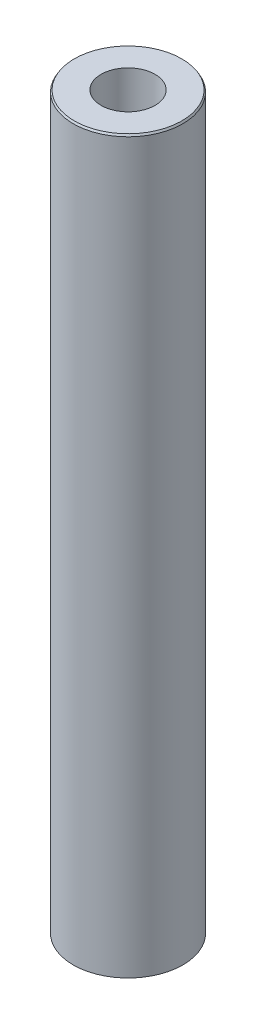
from build123d import *
from OCP.BRepFilletAPI import BRepFilletAPI_MakeChamfer

# Parameters (mm, degrees)
SKETCH1_R           = 45
BOSS_EXTRUDE1_DEPTH = 600
SKETCH2_R           = 22.121768631
CUT_EXTRUDE1_DEPTH  = 604.365560834
CHAMFER1_SIZE       = 1.550020342
CHAMFER1_SIZE2      = 0.894904662


with BuildPart() as part:
    # Sketch1 → Boss-Extrude1 (new body)
    with BuildSketch(Plane(origin=(0, 0, 0), x_dir=(1, 0, 0), z_dir=(0, 1, 0))):
        Circle(SKETCH1_R)
    extrude(amount=BOSS_EXTRUDE1_DEPTH)

    # Sketch2 → Cut-Extrude1 (cut, through all)
    with BuildSketch(Plane(origin=(0, 0, 0), x_dir=(1, 0, 0), z_dir=(0, 1, 0))):
        Circle(SKETCH2_R)
    extrude(amount=CUT_EXTRUDE1_DEPTH, mode=Mode.SUBTRACT)

    # Chamfer1: one chamfer whose edges measure the first distance from different faces: ONE call of the kernel's chamfer builder (chamfer() names one face for all edges)
    chamfer1_edges_1 = [part.edges().sort_by_distance(p)[0] for p in [
        (-45, 600, 0),
    ]]
    chamfer1_side_1 = [part.faces().sort_by_distance(p)[0] for p in [
        (-45, 300, 0),
    ]]
    chamfer1_edges_2 = [part.edges().sort_by_distance(p)[0] for p in [
        (-45, 0, 0),
    ]]
    chamfer1_side_2 = [part.faces().sort_by_distance(p)[0] for p in [
        (-43.727207794, 0, 0),
    ]]
    chamfer1 = BRepFilletAPI_MakeChamfer(part.part.solid().wrapped)
    for e in chamfer1_edges_1:
        chamfer1.Add(CHAMFER1_SIZE, CHAMFER1_SIZE2, e.wrapped, chamfer1_side_1[0].wrapped)  # the first distance lies on this face
    for e in chamfer1_edges_2:
        chamfer1.Add(CHAMFER1_SIZE, CHAMFER1_SIZE2, e.wrapped, chamfer1_side_2[0].wrapped)  # the first distance lies on this face
    add(Compound.cast(chamfer1.Shape()), mode=Mode.REPLACE)


solid = part.part
